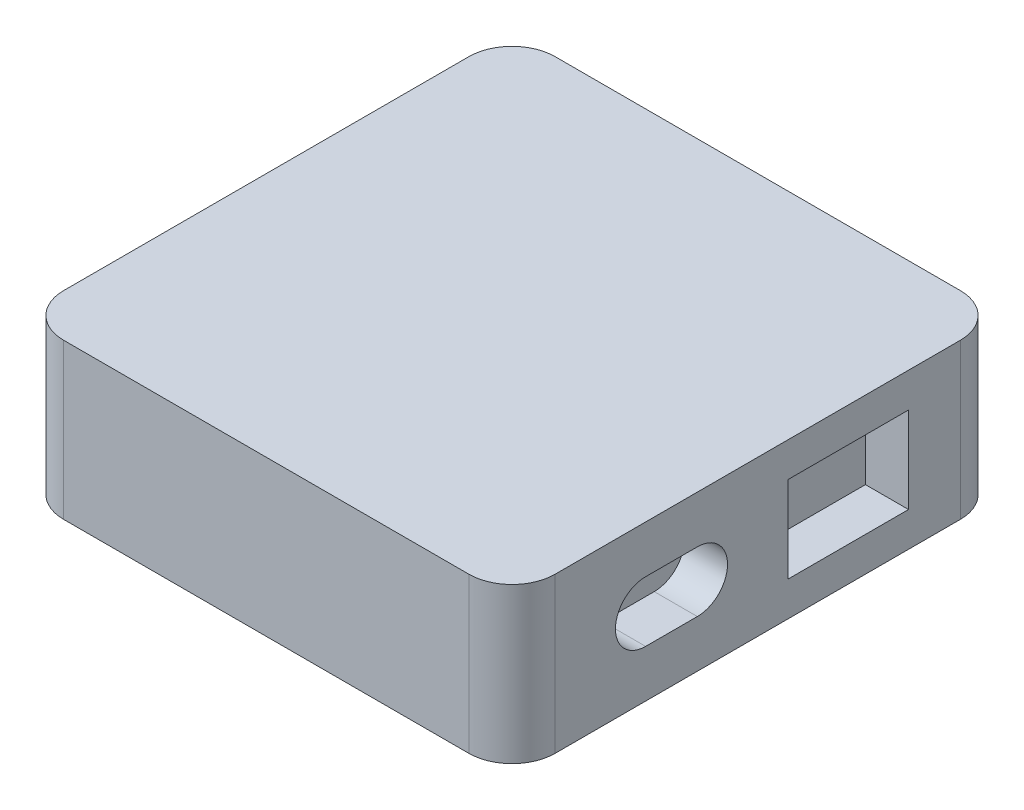
from build123d import *

# Parameters (mm, degrees)
CROQUIS1_W              = 57
CROQUIS1_H              = 57
SALIENTE_EXTRUIR1_DEPTH = 18
REDONDEO1_R             = 5
CROQUIS2_W              = 14
CROQUIS2_H              = 10
CORTAR_EXTRUIR1_DEPTH   = 5


with BuildPart() as part:
    # Croquis1 → Saliente-Extruir1 (new body)
    with BuildSketch(Plane(origin=(0, 0, 0), x_dir=(1, 0, 0), z_dir=(0, 1, 0))):
        Rectangle(CROQUIS1_W, CROQUIS1_H)
    extrude(amount=SALIENTE_EXTRUIR1_DEPTH)

    # Redondeo1
    redondeo1_edges = [part.edges().sort_by_distance(p)[0] for p in [
        (-28.5, 9, -28.5),
        (28.5, 9, -28.5),
        (-28.5, 9, 28.5),
        (28.5, 9, 28.5),
    ]]
    fillet(redondeo1_edges, radius=REDONDEO1_R)

    # Croquis2 → Cortar-Extruir1 (cut)
    with BuildSketch(Plane(origin=(28.5, 0, 0), x_dir=(0, 0, -1), z_dir=(1, 0, 0))):
        with BuildLine():
            Line((-13, 12.5), (-7, 12.5))
            ThreePointArc((-7, 12.5), (-3.5, 9), (-7, 5.5))
            Line((-7, 5.5), (-13, 5.5))
            ThreePointArc((-13, 5.5), (-16.5, 9), (-13, 12.5))
        make_face()
        with Locations((10.5, 9)):
            Rectangle(CROQUIS2_W, CROQUIS2_H)
    extrude(amount=-CORTAR_EXTRUIR1_DEPTH, mode=Mode.SUBTRACT)


solid = part.part
